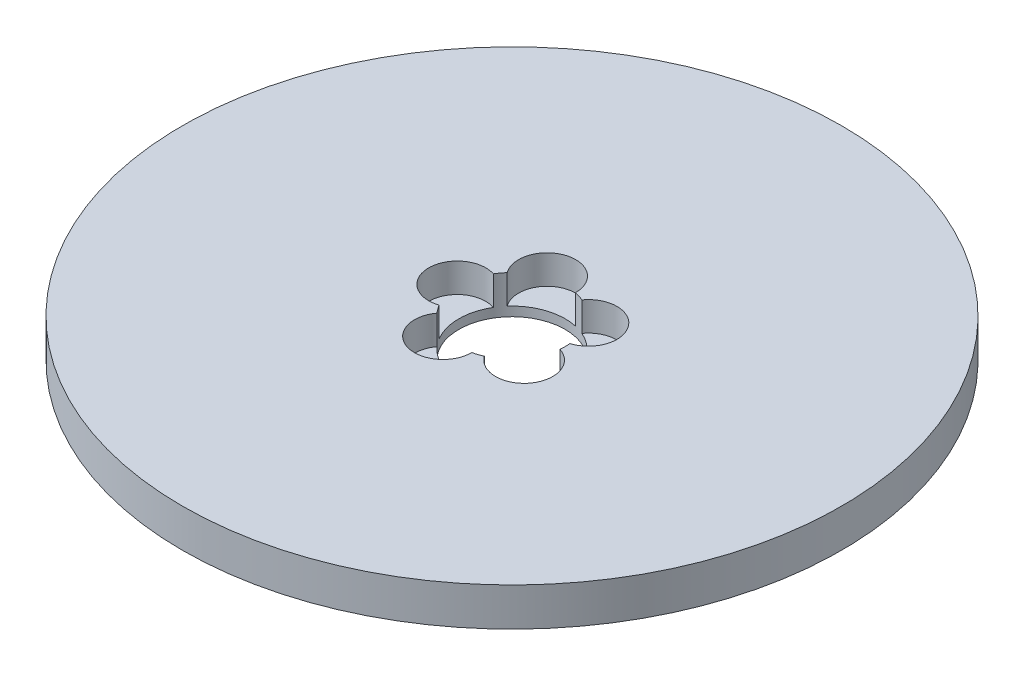
from build123d import *

# Parameters (mm, degrees)
SKETCH1_R           = 77.5
BOSS_EXTRUDE1_DEPTH = 9
SKETCH2_R           = 12.5
CUT_EXTRUDE1_DEPTH  = 110.970450577
SKETCH3_R           = 6.715858688
CUT_EXTRUDE2_DEPTH  = 6.828415668
CIRPATTERN1_COUNT   = 5


with BuildPart() as part:
    # Sketch1 → Boss-Extrude1 (new body)
    with BuildSketch(Plane(origin=(0, 0, 0), x_dir=(1, 0, 0), z_dir=(0, 1, 0))):
        Circle(SKETCH1_R)
    extrude(amount=BOSS_EXTRUDE1_DEPTH)

    # Sketch2 → Cut-Extrude1 (cut, through all)
    with BuildSketch(Plane(origin=(0, 0, 0), x_dir=(1, 0, 0), z_dir=(0, 1, 0))):
        Circle(SKETCH2_R)
    extrude(amount=CUT_EXTRUDE1_DEPTH, mode=Mode.SUBTRACT)

    # Sketch3 → Cut-Extrude2 (cut)
    with BuildSketch(Plane(origin=(0, 9, 0), x_dir=(1, 0, 0), z_dir=(0, 1, 0))):
        with Locations((-12.872795761, 0)):
            Circle(SKETCH3_R)
    cut_extrude2 = extrude(amount=-CUT_EXTRUDE2_DEPTH, mode=Mode.SUBTRACT)

    # CirPattern1: Cut-Extrude2 ×5 about axis
    cirpattern1_axis = Axis((0, 0, 0), (0, 1, 0))
    for i in range(1, CIRPATTERN1_COUNT):
        add(cut_extrude2.rotate(cirpattern1_axis, i * 360 / CIRPATTERN1_COUNT), mode=Mode.SUBTRACT)


solid = part.part
